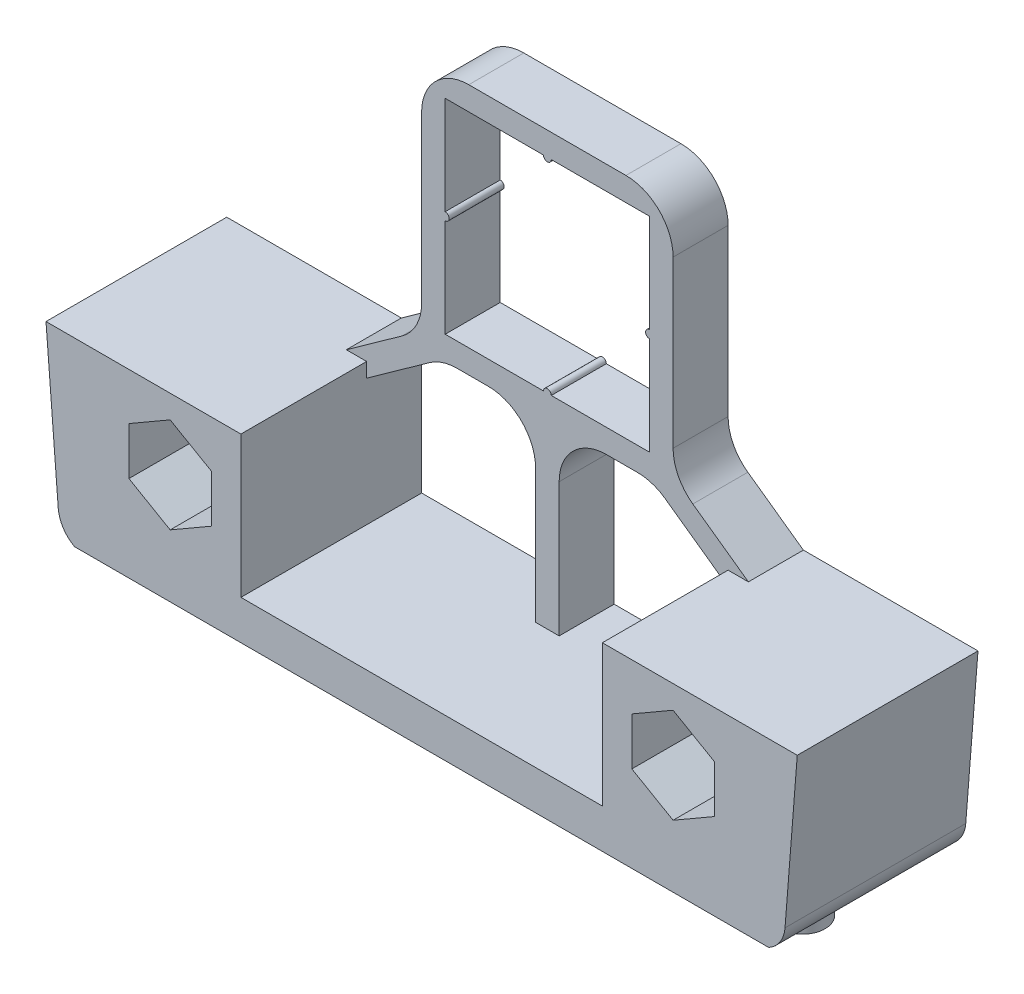
from build123d import *

# Parameters (mm, degrees)
BOSS_EXTRUDE1_DEPTH = 11.5
SKETCH2_W           = 45.5
SKETCH2_H           = 9.25
CUT_EXTRUDE1_DEPTH  = 4
SKETCH3_R           = 1.45
BOSS_EXTRUDE2_DEPTH = 1.8
CUT_EXTRUDE2_REACH  = 32.72
SKETCH4_W           = 3
SKETCH4_H           = 2.25
BOSS_EXTRUDE3_DEPTH = 3.5
FILLET1_R           = 3


with BuildPart() as part:
    # Sketch1 → Boss-Extrude1 (new body)
    with BuildSketch(Plane.XY):
        with BuildLine():
            Line((-23.900700066, -76.5), (-23.121499045, -86.400687699))
            ThreePointArc((-23.121499045, -86.400687699), (-22.608100633, -87.588503122), (-21.474960733, -88.213385013))
            Line((-21.474960733, -88.213385013), (0, -92))
            Line((0, -92), (21.474960733, -88.213385013))
            ThreePointArc((21.474960733, -88.213385013), (22.608100633, -87.588503122), (23.121499045, -86.400687699))
            Line((23.121499045, -86.400687699), (23.900700066, -76.5))
            Line((23.900700066, -76.5), (11.5, -76.5))
            Line((11.5, -76.5), (11.5, -85.5))
            Line((11.5, -85.5), (-11.5, -85.5))
            Line((-11.5, -85.5), (-11.5, -76.5))
            Line((-11.5, -76.5), (-23.900700066, -76.5))
        make_face()
        Polygon((-18.625, -82.515544457), (-18.625, -79.484455543), (-16, -77.968911087), (-13.375, -79.484455543), (-13.375, -82.515544457), (-16, -84.031088913), align=None, mode=Mode.SUBTRACT)
        Polygon((13.375, -82.515544457), (13.375, -79.484455543), (16, -77.968911087), (18.625, -79.484455543), (18.625, -82.515544457), (16, -84.031088913), align=None, mode=Mode.SUBTRACT)
    extrude(amount=BOSS_EXTRUDE1_DEPTH)

    # Sketch2 → Cut-Extrude1 (cut)
    with BuildSketch(Plane(origin=(0, -92, 0), x_dir=(1, 0, 0), z_dir=(0, 1, 0))):
        with Locations((0, -6.875)):
            Rectangle(SKETCH2_W, SKETCH2_H)
    extrude(amount=CUT_EXTRUDE1_DEPTH, mode=Mode.SUBTRACT)

    # Sketch3 → Boss-Extrude2 (add)
    with BuildSketch(Plane.XZ.offset(88)):
        with Locations((-19.6, 6.875)):
            Circle(SKETCH3_R)
        with Locations((19.6, 6.875)):
            Circle(SKETCH3_R)
    extrude(amount=BOSS_EXTRUDE2_DEPTH)

    # Sketch4 → Cut-Extrude2 (cut, up to next)
    with BuildSketch(Plane(origin=(0, -92, 0), x_dir=(1, 0, 0), z_dir=(0, 1, 0)), mode=Mode.PRIVATE) as cut_extrude2_sk1:
        with Locations((5.78456273, -1.125)):
            Rectangle(SKETCH4_W, SKETCH4_H)
    cut_extrude2_tool1 = extrude(cut_extrude2_sk1.sketch, amount=CUT_EXTRUDE2_REACH, mode=Mode.PRIVATE) & part.part
    add(cut_extrude2_tool1.solids().sort_by_distance((5.784563, -92, 1.125))[0], mode=Mode.SUBTRACT)


with BuildPart() as body_2:
    # Sketch5 → Boss-Extrude3 (new body)
    with BuildSketch(Plane(origin=(0, 0, 0), x_dir=(-1, 0, 0), z_dir=(0, 0, -1))):
        Polygon((8, -73.078322293), (8, -58), (-8, -58), (-8, -73.078322293), (-12.79034879, -76.5), (-11.5, -76.5), (-11.5, -77.421677707), (-6.70965121, -74), (-0.75, -74), (-0.75, -85.5), (0.75, -85.5), (0.75, -74), (6.70965121, -74), (11.5, -77.421677707), (11.5, -76.5), (12.79034879, -76.5), align=None)
        with BuildLine():
            ThreePointArc((-0.25, -59.5), (0, -59.75), (0.25, -59.5))
            Line((0.25, -59.5), (6.5, -59.5))
            Line((6.5, -59.5), (6.5, -65.75))
            ThreePointArc((6.5, -65.75), (6.25, -66), (6.5, -66.25))
            Line((6.5, -66.25), (6.5, -72.5))
            Line((6.5, -72.5), (0.25, -72.5))
            ThreePointArc((0.25, -72.5), (0, -72.25), (-0.25, -72.5))
            Line((-0.25, -72.5), (-6.5, -72.5))
            Line((-6.5, -72.5), (-6.5, -66.25))
            ThreePointArc((-6.5, -66.25), (-6.25, -66), (-6.5, -65.75))
            Line((-6.5, -65.75), (-6.5, -59.5))
            Line((-6.5, -59.5), (-0.25, -59.5))
        make_face(mode=Mode.SUBTRACT)
    extrude(amount=-BOSS_EXTRUDE3_DEPTH)

    # Fillet1
    fillet1_edges = [body_2.edges().sort_by_distance(p)[0] for p in [
        (0.75, -74, 1.75),
        (-0.75, -74, 1.75),
        (-6.70965121, -74, 1.75),
        (6.70965121, -74, 1.75),
        (8, -58, 1.75),
        (-8, -58, 1.75),
        (-8, -73.078322293, 1.75),
        (8, -73.078322293, 1.75),
    ]]
    fillet(fillet1_edges, radius=FILLET1_R)


solid = Compound([part.part, body_2.part])
